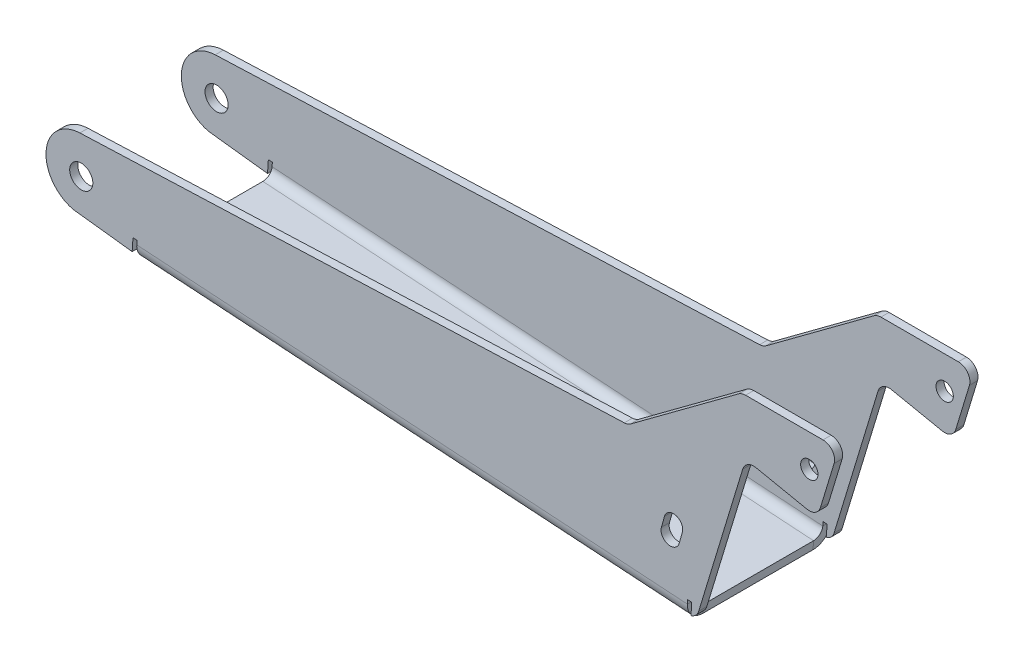
from build123d import *

# Parameters (mm, degrees)
SKETCH1_R                     = 1.5
SKETCH1_R_2                   = 2
BASE_FLANGE1_DEPTH            = 1.4
EDGE_FLANGE1_STRIP_W          = 8.6
EDGE_FLANGE1_STRIP_H          = 1.4
EDGE_FLANGE1_STRIP_CUT_DEPTH  = 95.413569059
EDGE_FLANGE1_RELIEF_W         = 9.3
EDGE_FLANGE1_RELIEF_H         = 0.7
EDGE_FLANGE1_RELIEF_CUT_DEPTH = 1.4
EDGE_FLANGE1_DEPTH            = 95.413569059


# Sheet-metal steps are written as plain solids
with BuildPart() as part:
    # Sketch1 → Base-Flange1 (new body)
    with BuildSketch(Plane.XY):
        with BuildLine():
            Line((170.912926542, 175.40661908), (266.125044601, 169.209705713))
            ThreePointArc((266.125044601, 169.209705713), (267.39344589, 169.561157821), (268.168771741, 170.624750901))
            Line((268.168771741, 170.624750901), (275.774482778, 195.689745971))
            ThreePointArc((275.774482778, 195.689745971), (276.665177338, 196.827499007), (278.089902914, 197.068280651))
            Line((278.089902914, 197.068280651), (286.893064256, 195.263905966))
            ThreePointArc((286.893064256, 195.263905966), (288.317789833, 195.50468761), (289.208484393, 196.642440646))
            Line((289.208484393, 196.642440646), (291.575051406, 204.441578719))
            ThreePointArc((291.575051406, 204.441578719), (291.26768584, 206.213641138), (289.661220117, 207.02231084))
            Line((289.661220117, 207.02231084), (276.272582238, 207.02231084))
            ThreePointArc((276.272582238, 207.02231084), (275.645401821, 206.921427667), (275.081493354, 206.628955565))
            Line((275.081493354, 206.628955565), (256.422617181, 192.796164997))
            ThreePointArc((256.422617181, 192.796164997), (255.8954918, 192.516238104), (255.30923711, 192.404319956))
            Line((255.30923711, 192.404319956), (161.178140888, 188.744148243))
            ThreePointArc((161.178140888, 188.744148243), (155.343352432, 183.233583314), (160.019332793, 176.710831608))
            Line((160.019332793, 176.710831608), (170.912926542, 175.40661908))
        make_face()
        with Locations((287.294653103, 201.429207007)):
            Circle(SKETCH1_R, mode=Mode.SUBTRACT)
        with Locations((161.415148292, 182.342793615)):
            Circle(SKETCH1_R_2, mode=Mode.SUBTRACT)
        with BuildLine():
            Line((261.718420137, 179.964788264), (262.260552067, 181.889909811))
            ThreePointArc((262.260552067, 181.889909811), (264.234354849, 182.996301504), (265.340746542, 181.022498723))
            Line((265.340746542, 181.022498723), (264.798614613, 179.097377176))
            ThreePointArc((264.798614613, 179.097377176), (262.824811831, 177.990985482), (261.718420137, 179.964788264))
        make_face(mode=Mode.SUBTRACT)
    extrude(amount=-BASE_FLANGE1_DEPTH)

    # Edge-Flange1 strip (across the edge) → Edge-Flange1 strip cut (cut)
    with BuildSketch(Plane(origin=(170.912926542, 175.40661908, 0), x_dir=(0.06494792541912509, 0.9978886546021816, 3.4914813388431334e-15), z_dir=(0.9978886546021816, -0.06494792541912509, 0))):
        with Locations((-2.8, -0.7)):
            Rectangle(EDGE_FLANGE1_STRIP_W, EDGE_FLANGE1_STRIP_H)
    extrude(amount=EDGE_FLANGE1_STRIP_CUT_DEPTH, mode=Mode.SUBTRACT)

    # Edge-Flange1 relief (on the sheet) → Edge-Flange1 relief cut (cut)
    with BuildSketch(Plane(origin=(171.01034843, 176.903452062, 0), x_dir=(0.06494792541912509, 0.9978886546021816, 6.982962677686267e-15), z_dir=(0, 0, 1))):
        with Locations((-3.95, 0.35)):
            Rectangle(EDGE_FLANGE1_RELIEF_W, EDGE_FLANGE1_RELIEF_H)
        with Locations((-3.95, -95.763569059)):
            Rectangle(EDGE_FLANGE1_RELIEF_W, EDGE_FLANGE1_RELIEF_H)
    extrude(amount=-EDGE_FLANGE1_RELIEF_CUT_DEPTH, mode=Mode.SUBTRACT)

    # Edge-Flange1 section (across the edge) → Edge-Flange1 (add)
    with BuildSketch(Plane(origin=(170.912926542, 175.40661908, 0), x_dir=(0.06494792541912509, 0.9978886546021816, 3.4914813388431334e-15), z_dir=(0.9978886546021816, -0.06494792541912509, 0))):
        with BuildLine():
            Line((-1.4, 1.5), (-1.4, 11))
            Line((-1.4, 11), (0, 11))
            Line((0, 11), (0, 1.5))
            ThreePointArc((0, 1.5), (0.439339828, 0.439339828), (1.5, 0))
            Line((1.5, 0), (1.5, -1.4))
            ThreePointArc((1.5, -1.4), (-0.550609665, -0.550609665), (-1.4, 1.5))
        make_face()
    extrude(amount=EDGE_FLANGE1_DEPTH)

    # Mirror1: part across plane


with BuildPart() as part_1:
    add(part.part)
    add(part.part.mirror(Plane(origin=(170.821999446, 174.009574964, 11), x_dir=(1, 0, 0), z_dir=(0, 0, -1))))


solid = part_1.part
